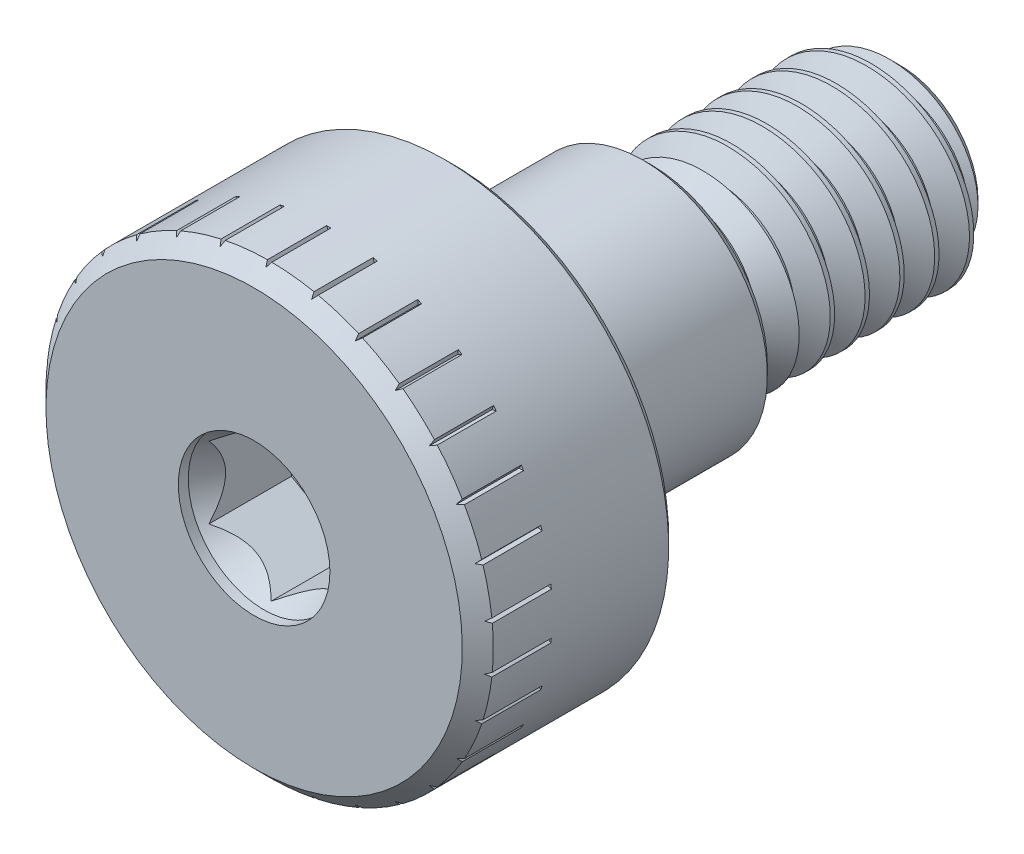
from build123d import *

# Parameters (mm, degrees)
CUT_EXTRUDE1_DEPTH = 2
SKETCH4_R          = 1.525
CUT_EXTRUDE2_DEPTH = 0.2
CUT_EXTRUDE3_START = -0.2
SKETCH4_2_R        = 1.525
CUT_EXTRUDE3_DEPTH = 1.5
CUT_EXTRUDE3_DRAFT = -30
CUT_SWEEP1_PITCH   = 0.7
CUT_EXTRUDE4_DEPTH = 1.5
CIRPATTERN1_COUNT  = 30


with BuildPart() as part:
    # Sketch2 → Revolve1 (revolve)
    with BuildSketch(Plane(origin=(0, 0, 0), x_dir=(0, 0, -1), z_dir=(1, 0, 0)), mode=Mode.PRIVATE) as revolve1_sk:
        with BuildLine():
            Line((6.5, 0), (6.5, 1.5625))
            Line((6.5, 1.5625), (6.0625, 2))
            Line((6.0625, 2), (2.531995005, 2))
            Line((2.531995005, 2), (2.077331668, 1.545336663))
            Line((2.077331668, 1.545336663), (1.727331668, 1.545336663))
            ThreePointArc((1.727331668, 1.545336663), (1.566583904, 1.611920567), (1.5, 1.772668332))
            Line((1.5, 1.772668332), (1.5, 2.325))
            Line((1.5, 2.325), (1.325, 2.5))
            Line((1.325, 2.5), (-1.436847276, 2.5))
            Line((-1.436847276, 2.5), (-1.7888, 2.2968))
            Line((-1.7888, 2.2968), (-1.8777, 2.2968))
            ThreePointArc((-1.8777, 2.2968), (-2.31773255, 2.47906745), (-2.5, 2.9191))
            Line((-2.5, 2.9191), (-2.5, 4.34))
            Line((-2.5, 4.34), (-2.66, 4.5))
            Line((-2.66, 4.5), (-6.1876, 4.5))
            Line((-6.1876, 4.5), (-6.5, 4.1876))
            Line((-6.5, 4.1876), (-6.5, 0))
            Line((-6.5, 0), (6.5, 0))
        make_face()
    revolve(revolve1_sk.sketch.rotate(Axis((0, 0, 6.5), (0, 0, -1)), 180), axis=Axis((0, 0, 6.5), (0, 0, -1)))

    # Sketch3 → Cut-Extrude1 (cut)
    with BuildSketch(Plane.XY.offset(6.5)):
        Polygon((0, 1.443375673), (-1.25, 0.721687836), (-1.25, -0.721687836), (0, -1.443375673), (1.25, -0.721687836), (1.25, 0.721687836), align=None)
    extrude(amount=-CUT_EXTRUDE1_DEPTH, mode=Mode.SUBTRACT)

    # Sketch4 → Cut-Extrude2 (cut)
    with BuildSketch(Plane.XY.offset(6.5)):
        Circle(SKETCH4_R)
    extrude(amount=-CUT_EXTRUDE2_DEPTH, mode=Mode.SUBTRACT)


with BuildPart() as cut_extrude3_tool:
    # Sketch4<2> → Cut-Extrude3 (with draft: the straight prism first)
    with BuildSketch(Plane.XY.offset(6.5).offset(CUT_EXTRUDE3_START)):
        Circle(SKETCH4_2_R)
    extrude(amount=-CUT_EXTRUDE3_DEPTH)
    # Cut-Extrude3: the draft: its side faces are tilted about the plane it starts from
    cut_extrude3_sides = [cut_extrude3_tool.faces().sort_by_distance(p)[0] for p in [
        (-1.525, 0, 5.55),
    ]]
    draft(cut_extrude3_sides, Plane.XY.offset(6.5).offset(CUT_EXTRUDE3_START), CUT_EXTRUDE3_DRAFT)


with BuildPart() as part_1:
    add(part.part)

    # Cut-Extrude3: cut by cut_extrude3_tool
    add(cut_extrude3_tool.part, mode=Mode.SUBTRACT)

    # Cut-Sweep1: the profile of Sketch6 profile screwed along a right-hand helix of 6.642857 turns, 6 arcs to a turn; built about Z, then put on its axis
    cut_sweep1_z = Axis((0, 0, 0), (0, 0, 1))
    cut_sweep1_corners = [(2.037888611, 0, 0.021875), (2.037888611, 0, -0.634375), (1.545036663, 0, -0.349826795), (1.545036663, 0, -0.262673205)]
    with BuildLine(mode=Mode.PRIVATE) as cut_sweep1_profile:
        Line(cut_sweep1_corners[0], cut_sweep1_corners[1])
        Line(cut_sweep1_corners[1], cut_sweep1_corners[2])
        Line(cut_sweep1_corners[2], cut_sweep1_corners[3])
        Line(cut_sweep1_corners[3], cut_sweep1_corners[0])
    cut_sweep1_cap = Face(cut_sweep1_profile.wire())
    cut_sweep1_turn_angles = [0, 30, 60, 90, 120, 150, 180, 210, 240, 270, 300, 330, 360]
    cut_sweep1_turn_weights = [1, 0.8660254037844387, 1, 0.8660254037844387, 1, 0.8660254037844387, 1, 0.8660254037844387, 1, 0.8660254037844387, 1, 0.8660254037844387, 1]
    cut_sweep1_turn_rails = [Edge.make_bspline([Vector(p[0], p[1], 0).rotate(cut_sweep1_z, cut_sweep1_turn_angles[k]) / cut_sweep1_turn_weights[k] + Vector(0, 0, p[2] + CUT_SWEEP1_PITCH * cut_sweep1_turn_angles[k] / 360) for k in range(13)], [0, 0, 0, 1, 1, 2, 2, 3, 3, 4, 4, 5, 5, 6, 6, 6], 2, cut_sweep1_turn_weights) for p in cut_sweep1_corners]
    cut_sweep1_turn_sides = [Face.make_surface_from_curves(cut_sweep1_turn_rails[p[0]], cut_sweep1_turn_rails[p[1]]) for p in [(0, 1), (1, 2), (2, 3), (3, 0)]]
    cut_sweep1_last_angles = [2160, 2190, 2220, 2250, 2280, 2310, 2340, 2365.714285714, 2391.428571429]
    cut_sweep1_last_weights = [1, 0.8660254037844387, 1, 0.8660254037844387, 1, 0.8660254037844387, 1, 0.9009688679023807, 1]
    cut_sweep1_last_rails = [Edge.make_bspline([Vector(p[0], p[1], 0).rotate(cut_sweep1_z, cut_sweep1_last_angles[k]) / cut_sweep1_last_weights[k] + Vector(0, 0, p[2] + CUT_SWEEP1_PITCH * cut_sweep1_last_angles[k] / 360) for k in range(9)], [0, 0, 0, 1, 1, 2, 2, 3, 3, 4, 4, 4], 2, cut_sweep1_last_weights) for p in cut_sweep1_corners]
    cut_sweep1_last_sides = [Face.make_surface_from_curves(cut_sweep1_last_rails[p[0]], cut_sweep1_last_rails[p[1]]) for p in [(0, 1), (1, 2), (2, 3), (3, 0)]]
    cut_sweep1 = Plane(origin=(0, 0, -6.5), x_dir=(0, 1, 0), z_dir=(0, 0, 1)) * Solid(Shell([*[p.moved(Location((0, 0, CUT_SWEEP1_PITCH * i))) for i in range(6) for p in cut_sweep1_turn_sides], *cut_sweep1_last_sides, cut_sweep1_cap, cut_sweep1_cap.rotate(cut_sweep1_z, 2391.428571429).moved(Location((0, 0, CUT_SWEEP1_PITCH * 2391.428571429 / 360)))]))
    add(cut_sweep1, mode=Mode.SUBTRACT)

    # Sketch7 → Cut-Extrude4 (cut)
    with BuildSketch(Plane.XY.offset(6.5)):
        Polygon((-0.04375, 4.5), (0, 4.424222777), (0.04375, 4.5), align=None)
    cut_extrude4 = extrude(amount=-CUT_EXTRUDE4_DEPTH, mode=Mode.SUBTRACT)

    # CirPattern1: Cut-Extrude4 ×30 about axis
    cirpattern1_axis = Axis((0, 0, 0), (0, 0, 1))
    for i in range(1, CIRPATTERN1_COUNT):
        add(cut_extrude4.rotate(cirpattern1_axis, i * 360 / CIRPATTERN1_COUNT), mode=Mode.SUBTRACT)


solid = part_1.part
